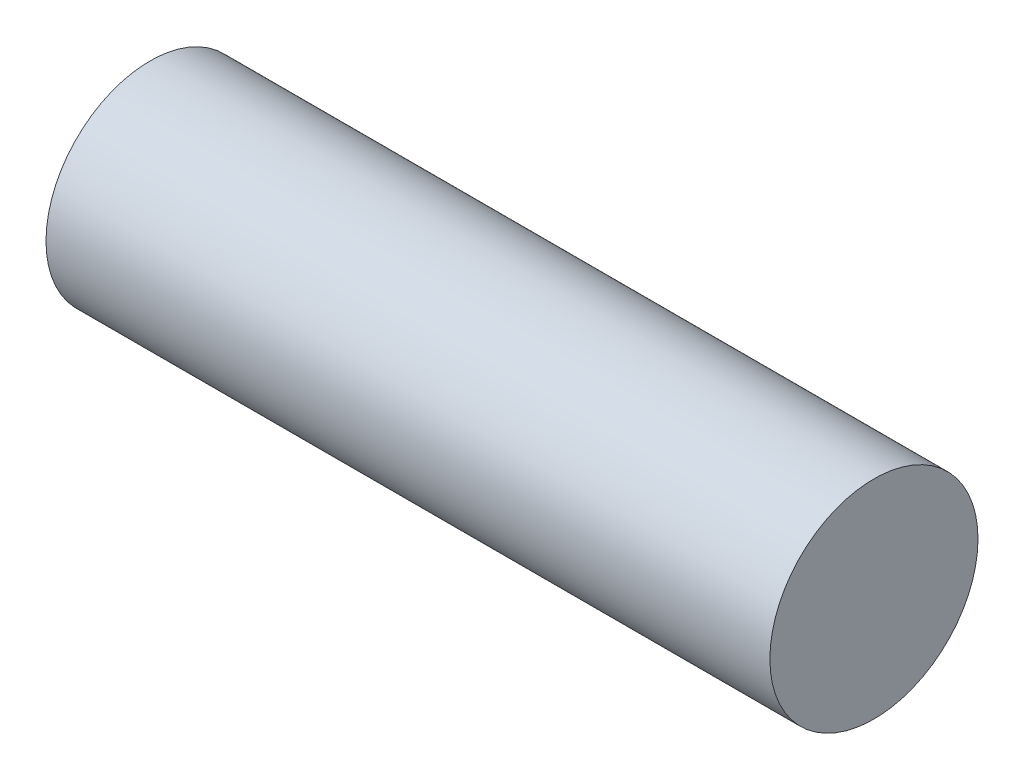
from build123d import *

# Parameters (mm, degrees)
SKETCH1_R           = 5.75
BOSS_EXTRUDE1_DEPTH = 40


with BuildPart() as part:
    # Sketch1 → Boss-Extrude1 (new body)
    with BuildSketch(Plane(origin=(0, 0, 0), x_dir=(0, 0, -1), z_dir=(1, 0, 0))):
        Circle(SKETCH1_R)
    extrude(amount=BOSS_EXTRUDE1_DEPTH)


solid = part.part
